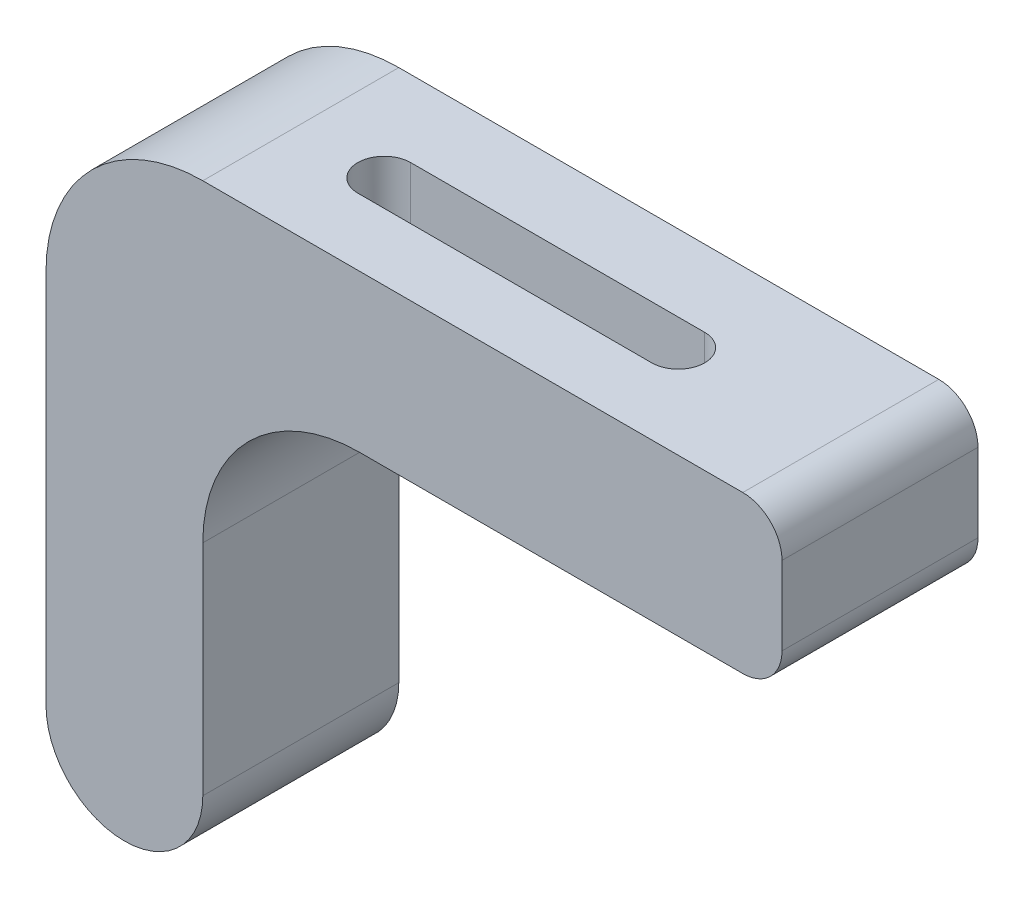
from build123d import *

# Parameters (mm, degrees)
BOSS_EXTRUDE1_DEPTH        = 10
M2_5_START                 = 36.310160318
M2_5_CLEARANCE_SLOT1_DEPTH = 16


with BuildPart() as part:
    # Sketch1 → Boss-Extrude1 (new body)
    with BuildSketch(Plane.XY):
        with BuildLine():
            Line((0, 25.135160318), (0, 44.310160318))
            ThreePointArc((0, 44.310160318), (2.343145751, 49.967014567), (8, 52.310160318))
            Line((8, 52.310160318), (35.55, 52.310160318))
            ThreePointArc((35.55, 52.310160318), (36.964213562, 51.72437388), (37.55, 50.310160318))
            Line((37.55, 50.310160318), (37.55, 46.310160318))
            ThreePointArc((37.55, 46.310160318), (36.964213562, 44.895946756), (35.55, 44.310160318))
            Line((35.55, 44.310160318), (16, 44.310160318))
            ThreePointArc((16, 44.310160318), (10.343145751, 41.967014567), (8, 36.310160318))
            Line((8, 36.310160318), (8, 25.135160318))
            ThreePointArc((8, 25.135160318), (4, 21.135160318), (0, 25.135160318))
        make_face()
    extrude(amount=BOSS_EXTRUDE1_DEPTH)

    # M2.5 Clearance Slot1: read off the stored shape, not the designer's step
    # M2.5 Clearance Slot1 outline → M2.5 Clearance Slot1 (cut)
    with BuildSketch(Plane(origin=(0, 0, 0), x_dir=(1, 0, 0), z_dir=(0, 1, 0)).offset(M2_5_START)):
        with BuildLine():
            Line((12.5, -6.593666906), (27.5, -6.593666906))
            ThreePointArc((27.5, -6.593666906), (28.85, -5.243666906), (27.5, -3.893666906))
            Line((27.5, -3.893666906), (12.5, -3.893666906))
            ThreePointArc((12.5, -3.893666906), (11.15, -5.243666906), (12.5, -6.593666906))
        make_face()
    extrude(amount=M2_5_CLEARANCE_SLOT1_DEPTH, mode=Mode.SUBTRACT)


solid = part.part
